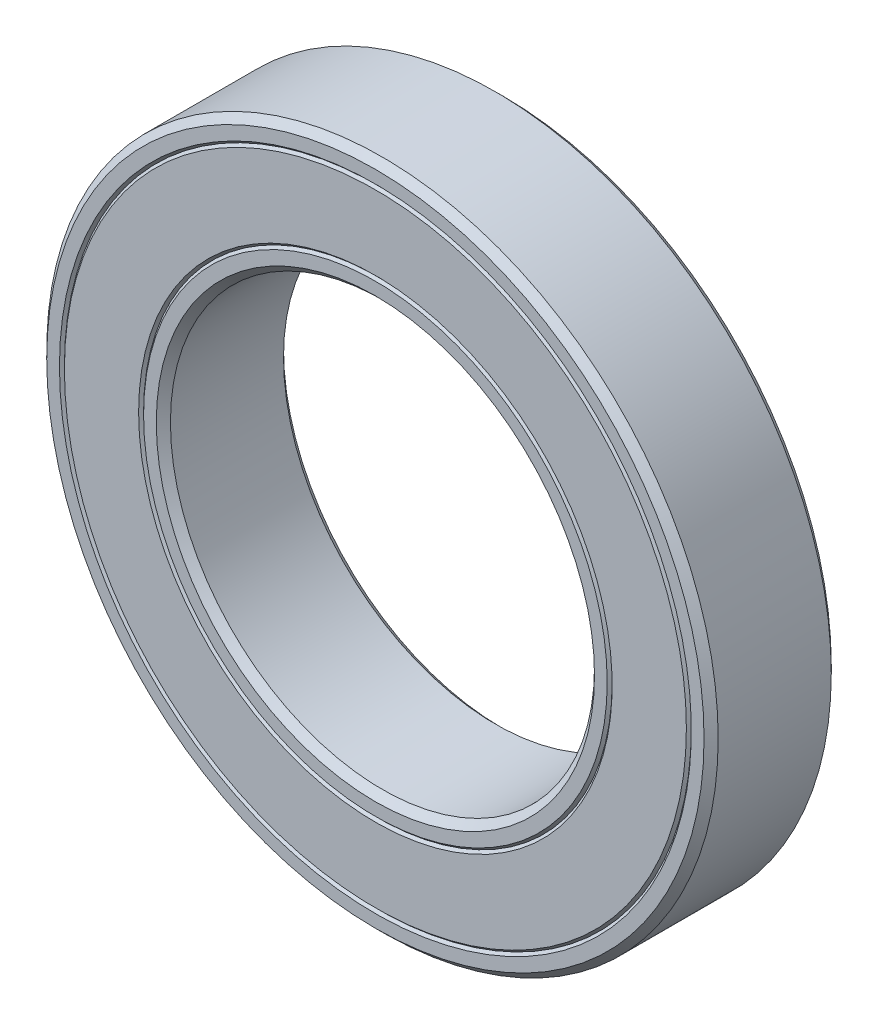
from build123d import *

# Parameters (mm, degrees)
SKETCH1_R      = 47.5
SKETCH1_R_2    = 30
EXTRUDE1_DEPTH = 18
CHAMFER1_SIZE  = 1


with BuildPart() as part:
    # Sketch1 → Extrude1 (new body)
    with BuildSketch(Plane.XY):
        Circle(SKETCH1_R)
        Circle(SKETCH1_R_2, mode=Mode.SUBTRACT)
    extrude(amount=EXTRUDE1_DEPTH)

    # Chamfer1
    chamfer1_edges = [part.edges().sort_by_distance(p)[0] for p in [
        (-30, 0, 0),
        (-30, 0, 18),
        (-47.5, 0, 0),
        (-47.5, 0, 18),
    ]]
    chamfer(chamfer1_edges, length=CHAMFER1_SIZE)

    # Sketch2 → Cut-Revolve1 (revolve, cut)
    with BuildSketch(Plane(origin=(0, 0, 0), x_dir=(0, 0, -1), z_dir=(1, 0, 0))):
        Polygon((-18, 32.8), (-17.65, 33.15), (-18, 33.5), align=None)
        Polygon((-17.65, 44.35), (-18, 44), (-18, 44.7), align=None)
        Polygon((0, 32.8), (0, 33.5), (-0.35, 33.15), align=None)
        Polygon((0, 44.7), (0, 44), (-0.35, 44.35), align=None)
    revolve(axis=Axis((0, 0, 0), (0, 0, 1)), mode=Mode.SUBTRACT)


solid = part.part
